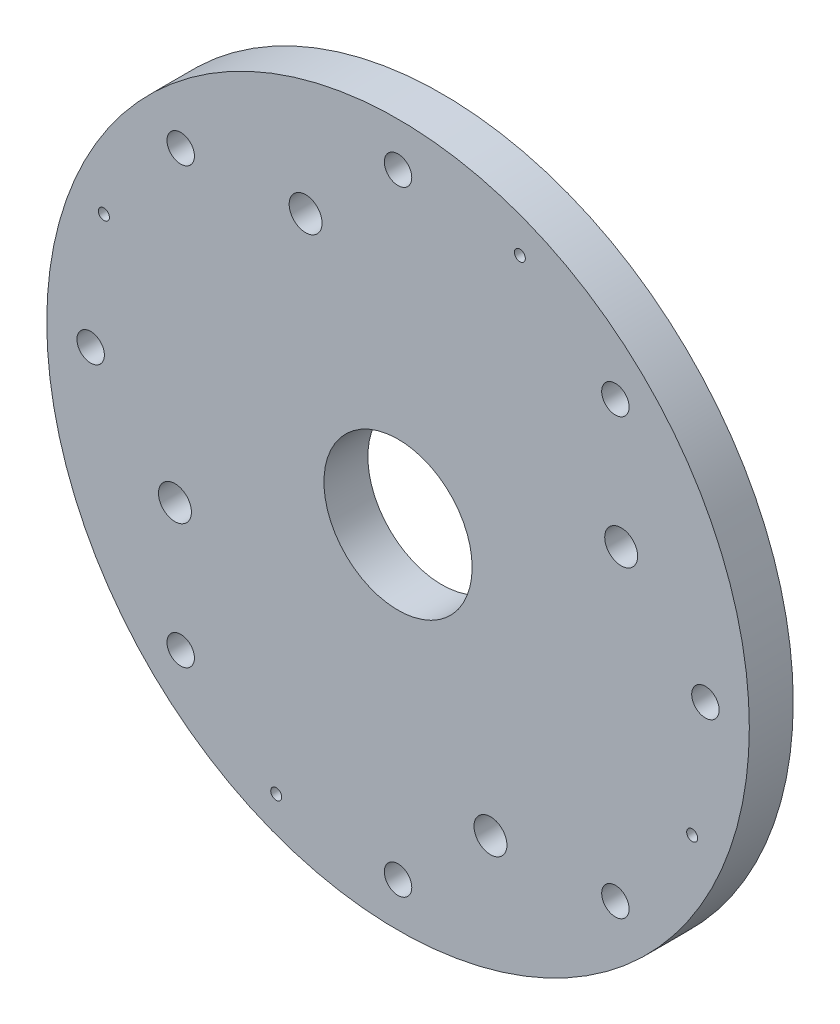
from build123d import *

# Parameters (mm, degrees)
CROQUIS1_R              = 32
SALIENTE_EXTRUIR1_DEPTH = 4
CROQUIS2_R              = 1.25
CORTAR_EXTRUIR1_DEPTH   = 46.431266766
CROQUIS3_R              = 6.75
CORTAR_EXTRUIR2_DEPTH   = 10
CROQUIS4_R              = 0.5
CORTAR_EXTRUIR3_DEPTH   = 10
CROQUIS5_R              = 1.5
CORTAR_EXTRUIR4_DEPTH   = 10
SALIENTE_EXTRUIR3_DEPTH = 5
CROQUIS7_R              = 0.75
CORTAR_EXTRUIR5_DEPTH   = 67.307168953
MATRIZC1_COUNT          = 4


with BuildPart() as part:
    # Croquis1 → Saliente-Extruir1 (new body)
    with BuildSketch(Plane.XY):
        Circle(CROQUIS1_R)
    extrude(amount=SALIENTE_EXTRUIR1_DEPTH)

    # Croquis2 → Cortar-Extruir1 (cut, through all)
    with BuildSketch(Plane.XY.offset(4)):
        with Locations((0, 28)):
            Circle(CROQUIS2_R)
        with Locations((19.798989873, 19.798989873)):
            Circle(CROQUIS2_R)
        with Locations((28, 0)):
            Circle(CROQUIS2_R)
        with Locations((19.798989873, -19.798989873)):
            Circle(CROQUIS2_R)
        with Locations((0, -28)):
            Circle(CROQUIS2_R)
        with Locations((-19.798989873, -19.798989873)):
            Circle(CROQUIS2_R)
        with Locations((-28, 0)):
            Circle(CROQUIS2_R)
        with Locations((-19.798989873, 19.798989873)):
            Circle(CROQUIS2_R)
    extrude(amount=-CORTAR_EXTRUIR1_DEPTH, mode=Mode.SUBTRACT)

    # Croquis3 → Cortar-Extruir2 (cut)
    with BuildSketch(Plane.XY.offset(4)):
        Circle(CROQUIS3_R)
    extrude(amount=-CORTAR_EXTRUIR2_DEPTH, mode=Mode.SUBTRACT)

    # Croquis4 → Cortar-Extruir3 (cut)
    with BuildSketch(Plane(origin=(0, 0, 0), x_dir=(-1, 0, 0), z_dir=(0, 0, -1))):
        with Locations((-11.097819539, 26.792506443)):
            Circle(CROQUIS4_R)
        with Locations((26.792506443, 11.097819539)):
            Circle(CROQUIS4_R)
        with Locations((11.097819539, -26.792506443)):
            Circle(CROQUIS4_R)
        with Locations((-26.792506443, -11.097819539)):
            Circle(CROQUIS4_R)
    extrude(amount=-CORTAR_EXTRUIR3_DEPTH, mode=Mode.SUBTRACT)

    # Croquis5 → Cortar-Extruir4 (cut)
    with BuildSketch(Plane(origin=(0, 0, 0), x_dir=(-1, 0, 0), z_dir=(0, 0, -1))):
        with Locations((8.419035512, 20.325349715)):
            Circle(CROQUIS5_R)
        with Locations((20.325349715, -8.419035512)):
            Circle(CROQUIS5_R)
        with Locations((-8.419035512, -20.325349715)):
            Circle(CROQUIS5_R)
        with Locations((-20.325349715, 8.419035512)):
            Circle(CROQUIS5_R)
    extrude(amount=-CORTAR_EXTRUIR4_DEPTH, mode=Mode.SUBTRACT)

    # Croquis6 → Saliente-Extruir3 (add)
    with BuildSketch(Plane.XY):
        Polygon((6.571276447, 21.09071658), (10.266794577, 19.559982851), (8.736060848, 15.86446472), (5.040542718, 17.39519845), align=None)
        Polygon((-21.09071658, 6.571276447), (-17.39519845, 5.040542718), (-15.86446472, 8.736060848), (-19.559982851, 10.266794577), align=None)
        Polygon((21.09071658, -6.571276447), (19.559982851, -10.266794577), (15.86446472, -8.736060848), (17.39519845, -5.040542718), align=None)
        Polygon((-6.571276447, -21.09071658), (-10.266794577, -19.559982851), (-8.736060848, -15.86446472), (-5.040542718, -17.39519845), align=None)
    extrude(amount=-SALIENTE_EXTRUIR3_DEPTH)

    # Croquis7 → Cortar-Extruir5 (cut, through all)
    with BuildSketch(Plane(origin=(-8.419035512, -20.325349715, 0), x_dir=(0.9238795325112903, -0.3826834323650813, 0), z_dir=(-0.3826834323650813, -0.9238795325112903, 0))):
        with Locations((0, -2.5)):
            Circle(CROQUIS7_R)
    cortar_extruir5 = extrude(amount=-CORTAR_EXTRUIR5_DEPTH, mode=Mode.SUBTRACT)

    # MatrizC1: Cortar-Extruir5 ×4 about axis
    matrizc1_axis = Axis((0, 0, -6), (0, 0, 1))
    for i in range(1, MATRIZC1_COUNT):
        add(cortar_extruir5.rotate(matrizc1_axis, i * 360 / MATRIZC1_COUNT), mode=Mode.SUBTRACT)


solid = part.part
